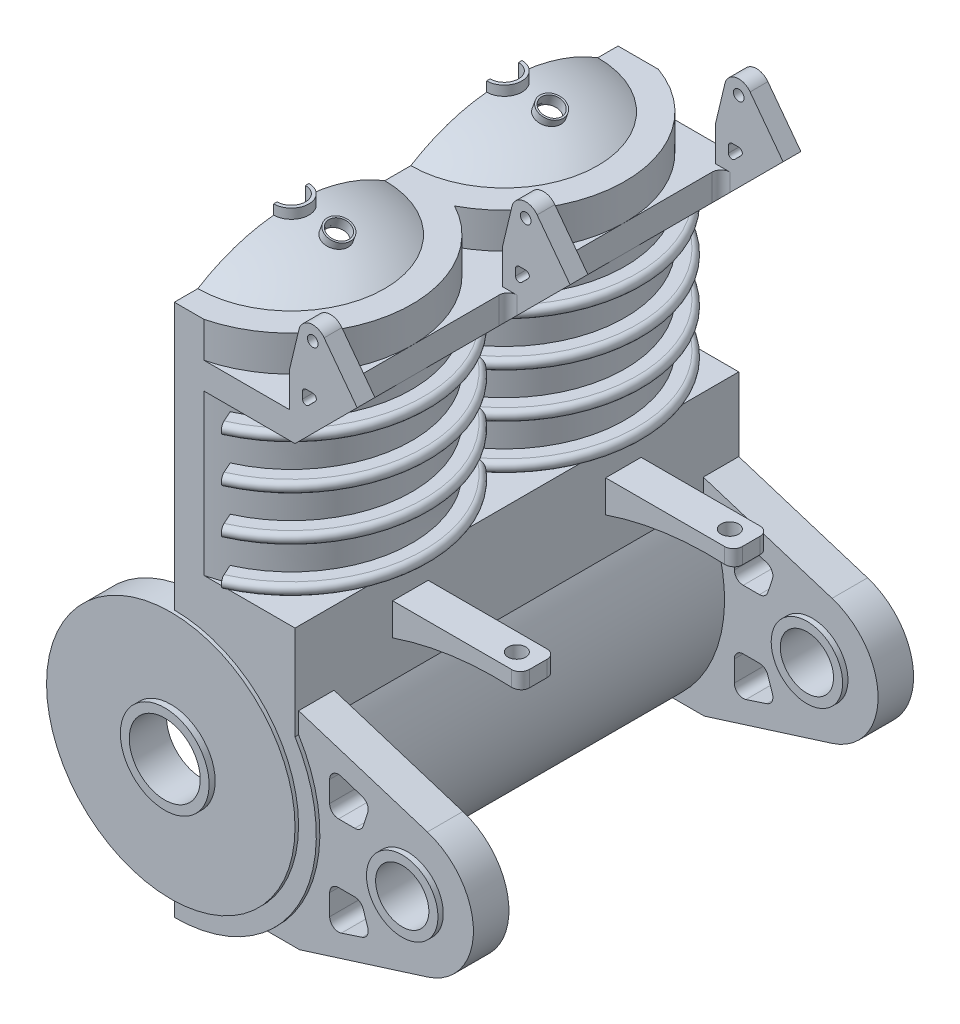
from build123d import *

# Parameters (mm, degrees)
BOSS_EXTRUDE1_DEPTH  = 25
SKETCH2_R            = 5
CUT_EXTRUDE1_DEPTH   = 20
SKETCH3_R            = 7
CUT_EXTRUDE2_DEPTH   = 39.394275615
CUT_EXTRUDE3_DEPTH   = 9
SKETCH6_W            = 0.51
SKETCH6_H            = 10
REVOLVE1_ANGLE       = 156
LPATTERN1_COUNT      = 2
LPATTERN1_PITCH      = 12
SKETCH7_R            = 5
CUT_EXTRUDE4_DEPTH   = 15
BOSS_EXTRUDE2_START  = -1
SKETCH8_R            = 7
SKETCH8_R_2          = 2.5
BOSS_EXTRUDE2_DEPTH  = 1.5
LPATTERN2_COUNT      = 3
LPATTERN2_PITCH      = 12
BOSS_EXTRUDE3_START  = 0.2
SKETCH9_R            = 2.5
BOSS_EXTRUDE3_DEPTH  = 0.2
BOSS_EXTRUDE4_START  = -1.6
SKETCH11_R           = 2.5
SKETCH11_R_2         = 2
BOSS_EXTRUDE4_DEPTH  = 2.1
LPATTERN3_COUNT      = 3
LPATTERN3_PITCH      = 12.22
BOSS_EXTRUDE5_START  = 2
BOSS_EXTRUDE5_DEPTH  = 2
SKETCH13_R           = 2.013
BOSS_EXTRUDE6_DEPTH  = 2
LPATTERN4_COUNT      = 2
LPATTERN4_PITCH      = 22.8
BOSS_EXTRUDE7_START  = 0.3
SKETCH14_R           = 2.013
SKETCH14_R_2         = 1.5
BOSS_EXTRUDE7_DEPTH  = 2.6
LPATTERN5_COUNT      = 2
LPATTERN5_PITCH      = 22.8
CUT_EXTRUDE5_DEPTH   = 43.786849685
REVOLVE7_ANGLE       = 180
LPATTERN6_COUNT      = 2
LPATTERN6_PITCH      = 12
SKETCH17_R           = 0.995
CUT_EXTRUDE6_DEPTH   = 43.786849615
BOSS_EXTRUDE8_START  = 1.2
BOSS_EXTRUDE8_DEPTH  = 0.8
SKETCH19_R           = 0.6
CUT_EXTRUDE11_DEPTH  = 41.399838707
SKETCH20_R           = 0.3
BOSS_EXTRUDE9_DEPTH  = 1
LPATTERN7_COUNT      = 3
LPATTERN7_PITCH      = 12
FILLET1_R            = 0.5
BOSS_EXTRUDE10_START = -5.5
BOSS_EXTRUDE10_DEPTH = 2
LPATTERN8_COUNT      = 2
LPATTERN8_PITCH      = 12
SKETCH22_R           = 0.5
CUT_EXTRUDE12_DEPTH  = 2
FILLET2_R            = 0.5
SKETCH23_W           = 8.786721834
SKETCH23_H           = 1.81963398
CUT_EXTRUDE13_DEPTH  = 45.697648838
SKETCH24_R           = 0.3
BOSS_EXTRUDE11_DEPTH = 1
LPATTERN9_COUNT      = 3
LPATTERN9_PITCH      = 12
EXTRUDE_THIN1_START  = 1.9
SKETCH19_2_R         = 0.7
SKETCH19_2_R_2       = 0.6
EXTRUDE_THIN1_DEPTH  = 0.5


with BuildPart() as part:
    # Sketch1 → Boss-Extrude1 (new body)
    with BuildSketch(Plane.XY):
        with BuildLine():
            Line((0, 0), (0, 28.02))
            Line((0, 28.02), (6.8, 28.02))
            Line((6.8, 28.02), (6.8, 12.214261501))
            ThreePointArc((6.8, 12.214261501), (6.989781542, 4.108605135), (0, 0))
        make_face()
    extrude(amount=BOSS_EXTRUDE1_DEPTH)

    # Sketch2 → Cut-Extrude1 (cut)
    with BuildSketch(Plane(origin=(0, 28.02, 0), x_dir=(1, 0, 0), z_dir=(0, 1, 0))):
        with Locations((0, -6.41)):
            Circle(SKETCH2_R)
        with Locations((0, -18.41)):
            Circle(SKETCH2_R)
    extrude(amount=-CUT_EXTRUDE1_DEPTH, mode=Mode.SUBTRACT)

    # Sketch3 → Cut-Extrude2 (cut, through all)
    with BuildSketch(Plane.XY.offset(25)):
        with Locations((0, 8)):
            Circle(SKETCH3_R)
    extrude(amount=-CUT_EXTRUDE2_DEPTH, mode=Mode.SUBTRACT)

    # Sketch4 → Cut-Extrude3 (cut)
    with BuildSketch(Plane(origin=(0, 26.52, 0), x_dir=(1, 0, 0), z_dir=(0, 1, 0))):
        with BuildLine():
            Line((0, 0.39), (11.867696921, 0.39))
            Line((11.867696921, 0.39), (11.867696921, -25.21))
            Line((11.867696921, -25.21), (0, -25.21))
            ThreePointArc((0, -25.21), (6.596969001, -20.05924225), (3.2, -12.41))
            ThreePointArc((3.2, -12.41), (6.596969001, -4.76075775), (0, 0.39))
        make_face()
    extrude(amount=-CUT_EXTRUDE3_DEPTH, mode=Mode.SUBTRACT)

    # Sketch6 → Revolve1 (revolve)
    with BuildSketch(Plane.ZY):
        with Locations((0.425, 22.17)):
            Rectangle(SKETCH6_W, SKETCH6_H)
        with BuildLine():
            Line((0.17, 25.87), (-1.07, 25.87))
            ThreePointArc((-1.07, 25.87), (-1.37, 25.57), (-1.07, 25.27))
            Line((-1.07, 25.27), (0.17, 25.27))
            Line((0.17, 25.27), (0.17, 25.87))
        make_face()
        with BuildLine():
            Line((0.17, 23.37), (-1.07, 23.37))
            ThreePointArc((-1.07, 23.37), (-1.37, 23.07), (-1.07, 22.77))
            Line((-1.07, 22.77), (0.17, 22.77))
            Line((0.17, 22.77), (0.17, 23.37))
        make_face()
        with BuildLine():
            Line((0.17, 20.87), (-1.07, 20.87))
            ThreePointArc((-1.07, 20.87), (-1.37, 20.57), (-1.07, 20.27))
            Line((-1.07, 20.27), (0.17, 20.27))
            Line((0.17, 20.27), (0.17, 20.87))
        make_face()
        with BuildLine():
            Line((0.17, 18.37), (-1.07, 18.37))
            ThreePointArc((-1.07, 18.37), (-1.37, 18.07), (-1.07, 17.77))
            Line((-1.07, 17.77), (0.17, 17.77))
            Line((0.17, 17.77), (0.17, 18.37))
        make_face()
    revolve1 = revolve(axis=Axis((0, 28.02, 6.41), (0, -1, 0)), revolution_arc=REVOLVE1_ANGLE)

    # LPattern1: Revolve1 ×2
    with Locations(*[(0, 0, i * LPATTERN1_PITCH) for i in range(1, LPATTERN1_COUNT)]):
        add(revolve1)

    # Sketch7 → Cut-Extrude4 (cut)
    with BuildSketch(Plane(origin=(0, 28.02, 0), x_dir=(1, 0, 0), z_dir=(0, 1, 0))):
        with Locations((0, -6.41)):
            Circle(SKETCH7_R)
    extrude(amount=-CUT_EXTRUDE4_DEPTH, mode=Mode.SUBTRACT)

    # Sketch8 → Boss-Extrude2 (add)
    with BuildSketch(Plane(origin=(0, 0, 0), x_dir=(-1, 0, 0), z_dir=(0, 0, -1)).offset(BOSS_EXTRUDE2_START)):
        with Locations((0, 8)):
            Circle(SKETCH8_R)
        with Locations((0, 8)):
            Circle(SKETCH8_R_2, mode=Mode.SUBTRACT)
    boss_extrude2 = extrude(amount=BOSS_EXTRUDE2_DEPTH)

    # LPattern2: Boss-Extrude2 ×3
    with Locations(*[(0, 0, i * LPATTERN2_PITCH) for i in range(1, LPATTERN2_COUNT)]):
        add(boss_extrude2)

    # Sketch9 → Boss-Extrude3 (add)
    with BuildSketch(Plane.XY.offset(25).offset(BOSS_EXTRUDE3_START)):
        with BuildLine():
            ThreePointArc((0, 1), (7, 8), (0, 15))
            ThreePointArc((0, 15), (-7, 8), (0, 1))
        make_face()
        with Locations((0, 8)):
            Circle(SKETCH9_R, mode=Mode.SUBTRACT)
    extrude(amount=-BOSS_EXTRUDE3_DEPTH)

    # Sketch11 → Boss-Extrude4 (add)
    with BuildSketch(Plane(origin=(0, 0, -0.5), x_dir=(-1, 0, 0), z_dir=(0, 0, -1)).offset(BOSS_EXTRUDE4_START)):
        with Locations((0, 8)):
            Circle(SKETCH11_R)
        with Locations((0, 8)):
            Circle(SKETCH11_R_2, mode=Mode.SUBTRACT)
    boss_extrude4 = extrude(amount=BOSS_EXTRUDE4_DEPTH)

    # LPattern3: Boss-Extrude4 ×3
    with Locations(*[(0, 0, i * LPATTERN3_PITCH) for i in range(1, LPATTERN3_COUNT)]):
        add(boss_extrude4)

    # Sketch12 → Boss-Extrude5 (add)
    with BuildSketch(Plane(origin=(0, 28.02, 0), x_dir=(1, 0, 0), z_dir=(0, 1, 0)).offset(BOSS_EXTRUDE5_START)):
        with BuildLine():
            Line((0, -13.41), (0, -11.41))
            ThreePointArc((0, -11.41), (5, -6.41), (0, -1.41))
            Line((0, -1.41), (0, 0))
            Line((0, 0), (2.269779725, 0))
            ThreePointArc((2.269779725, 0), (5.553129844, -2.485366395), (6.8, -6.41))
            ThreePointArc((6.8, -6.41), (5.830951895, -9.908571137), (3.2, -12.41))
            ThreePointArc((3.2, -12.41), (5.830951895, -14.911428863), (6.8, -18.41))
            ThreePointArc((6.8, -18.41), (5.368553353, -22.583563813), (1.676872088, -25))
            Line((1.676872088, -25), (0, -25))
            Line((0, -25), (0, -23.41))
            ThreePointArc((0, -23.41), (5, -18.41), (0, -13.41))
        make_face()
    extrude(amount=-BOSS_EXTRUDE5_DEPTH)

    # Sketch13 → Boss-Extrude6 (add)
    with BuildSketch(Plane(origin=(0, 0, 0), x_dir=(-1, 0, 0), z_dir=(0, 0, -1))):
        with BuildLine():
            Line((-6.8, 12.214261501), (-6.8, 13.385977618))
            Line((-6.8, 13.385977618), (-14.055618516, 11.098289887))
            ThreePointArc((-14.055618516, 11.098289887), (-16.65, 7.56), (-14.055618516, 4.021710113))
            Line((-14.055618516, 4.021710113), (-6.85574719, 1.751599403))
            Line((-6.85574719, 1.751599403), (-4.99574719, 1.751599403))
            ThreePointArc((-4.99574719, 1.751599403), (-7.883637326, 6.640491811), (-6.8, 12.214261501))
        make_face()
        with Locations((-12.94, 7.56)):
            Circle(SKETCH13_R, mode=Mode.SUBTRACT)
    boss_extrude6 = extrude(amount=-BOSS_EXTRUDE6_DEPTH)

    # LPattern4: Boss-Extrude6 ×2
    with Locations(*[(0, 0, i * LPATTERN4_PITCH) for i in range(1, LPATTERN4_COUNT)]):
        add(boss_extrude6)

    # Sketch14 → Boss-Extrude7 (add)
    with BuildSketch(Plane(origin=(0, 0, 0), x_dir=(-1, 0, 0), z_dir=(0, 0, -1)).offset(BOSS_EXTRUDE7_START)):
        with Locations((-12.94, 7.56)):
            Circle(SKETCH14_R)
        with Locations((-12.94, 7.56)):
            Circle(SKETCH14_R_2, mode=Mode.SUBTRACT)
    boss_extrude7 = extrude(amount=-BOSS_EXTRUDE7_DEPTH)

    # LPattern5: Boss-Extrude7 ×2
    with Locations(*[(0, 0, i * LPATTERN5_PITCH) for i in range(1, LPATTERN5_COUNT)]):
        add(boss_extrude7)

    # Sketch15 → Cut-Extrude5 (cut, through all)
    with BuildSketch(Plane(origin=(0, 0, 0), x_dir=(-1, 0, 0), z_dir=(0, 0, -1))):
        with BuildLine():
            Line((-9.206498261, 11.383474577), (-10.378351292, 10.999959039))
            ThreePointArc((-10.378351292, 10.999959039), (-10.668816803, 10.750807688), (-10.698030326, 10.369240944))
            Line((-10.698030326, 10.369240944), (-10.439308337, 9.578701533))
            ThreePointArc((-10.439308337, 9.578701533), (-10.257572065, 9.32940026), (-9.964109772, 9.234221063))
            Line((-9.964109772, 9.234221063), (-9.050978731, 9.234221063))
            ThreePointArc((-9.050978731, 9.234221063), (-8.69742534, 9.380667672), (-8.550978731, 9.734221063))
            Line((-8.550978731, 9.734221063), (-8.550978731, 10.908276012))
            ThreePointArc((-8.550978731, 10.908276012), (-8.757516438, 11.313096815), (-9.206498261, 11.383474577))
        make_face()
        with BuildLine():
            Line((-8.550978731, 5.385778937), (-8.550978731, 4.211723988))
            ThreePointArc((-8.550978731, 4.211723988), (-8.757516438, 3.806903185), (-9.206498261, 3.736525423))
            Line((-9.206498261, 3.736525423), (-10.378351292, 4.120040961))
            ThreePointArc((-10.378351292, 4.120040961), (-10.668816803, 4.369192312), (-10.698030326, 4.750759056))
            Line((-10.698030326, 4.750759056), (-10.439308337, 5.541298467))
            ThreePointArc((-10.439308337, 5.541298467), (-10.257572065, 5.79059974), (-9.964109772, 5.885778937))
            Line((-9.964109772, 5.885778937), (-9.050978731, 5.885778937))
            ThreePointArc((-9.050978731, 5.885778937), (-8.69742534, 5.739332328), (-8.550978731, 5.385778937))
        make_face()
    extrude(amount=-CUT_EXTRUDE5_DEPTH, mode=Mode.SUBTRACT)

    # Sketch16 → Revolve7 (revolve)
    with BuildSketch(Plane.ZY):
        with BuildLine():
            Line((18.41, 31.4), (18.41, 31.52))
            ThreePointArc((18.41, 31.52), (15.671387212, 31.137692031), (13.142173124, 30.02))
            Line((13.142173124, 30.02), (13.373691828, 30.02))
            ThreePointArc((13.373691828, 30.02), (15.799023171, 31.048756477), (18.41, 31.4))
        make_face()
    revolve7 = revolve(axis=Axis((0, 30.02, 18.41), (0, -1, 0)), revolution_arc=REVOLVE7_ANGLE)

    # LPattern6: Revolve7 ×2
    with Locations(*[(0, 0, -i * LPATTERN6_PITCH) for i in range(1, LPATTERN6_COUNT)]):
        add(revolve7)

    # Sketch17 → Cut-Extrude6 (cut, through all)
    with BuildSketch(Plane(origin=(0, 30.02, 0), x_dir=(1, 0, 0), z_dir=(0, 1, 0))):
        with Locations((0, -6.41)):
            Circle(SKETCH17_R)
        with Locations((0, -18.41)):
            Circle(SKETCH17_R)
    extrude(amount=CUT_EXTRUDE6_DEPTH, mode=Mode.SUBTRACT)

    # Sketch18 → Boss-Extrude8 (add)
    with BuildSketch(Plane(origin=(0, 30.02, 0), x_dir=(1, 0, 0), z_dir=(0, 1, 0)).offset(BOSS_EXTRUDE8_START)):
        with BuildLine():
            Line((0, -5.415), (0, -5.61))
            ThreePointArc((0, -5.61), (0.8, -6.41), (0, -7.21))
            Line((0, -7.21), (0, -7.405))
            ThreePointArc((0, -7.405), (0.995, -6.41), (0, -5.415))
        make_face()
        with BuildLine():
            Line((0, -17.415), (0, -17.61))
            ThreePointArc((0, -17.61), (0.8, -18.41), (0, -19.21))
            Line((0, -19.21), (0, -19.405))
            ThreePointArc((0, -19.405), (0.995, -18.41), (0, -17.415))
        make_face()
    extrude(amount=BOSS_EXTRUDE8_DEPTH)

    # Sketch19 → Cut-Extrude11 (cut, through all)
    with BuildSketch(Plane(origin=(9.648242021, 26.508327091, 0), x_dir=(0, 0, 1), z_dir=(0.34202014332565694, 0.9396926207859128, 0))):
        with Locations((6.41, -8.301008223)):
            Circle(SKETCH19_R)
        with Locations((18.396707779, -8.301008223)):
            Circle(SKETCH19_R)
    extrude(amount=CUT_EXTRUDE11_DEPTH, mode=Mode.SUBTRACT)

    # Sketch20 → Boss-Extrude9 (add)
    with BuildSketch(Plane(origin=(0, 0, 0), x_dir=(-1, 0, 0), z_dir=(0, 0, -1))):
        with BuildLine():
            Line((-6.8, 26.52), (-6.5, 26.52))
            Line((-6.5, 26.52), (-6.5, 30.02))
            Line((-6.5, 30.02), (-8.82, 30.02))
            Line((-8.82, 30.02), (-9.944299782, 31.144299782))
            ThreePointArc((-9.944299782, 31.144299782), (-10.707523601, 31.122306001), (-10.641615253, 30.361615253))
            Line((-10.641615253, 30.361615253), (-6.8, 26.52))
        make_face()
        with Locations((-10.315530842, 30.773068722)):
            Circle(SKETCH20_R, mode=Mode.SUBTRACT)
        with BuildLine():
            Line((-7.941705141, 29.141705141), (-7.563773985, 28.763773985))
            ThreePointArc((-7.563773985, 28.763773985), (-7.345815943, 28.720419435), (-7.222352629, 28.905195342))
            Line((-7.222352629, 28.905195342), (-7.222352629, 29.283126498))
            ThreePointArc((-7.222352629, 29.283126498), (-7.280931273, 29.424547854), (-7.422352629, 29.483126498))
            Line((-7.422352629, 29.483126498), (-7.800283785, 29.483126498))
            ThreePointArc((-7.800283785, 29.483126498), (-7.985059692, 29.359663184), (-7.941705141, 29.141705141))
        make_face(mode=Mode.SUBTRACT)
    boss_extrude9 = extrude(amount=-BOSS_EXTRUDE9_DEPTH)

    # LPattern7: Boss-Extrude9 ×3
    with Locations(*[(0, 0, i * LPATTERN7_PITCH) for i in range(1, LPATTERN7_COUNT)]):
        add(boss_extrude9)

    # Fillet1
    fillet1_edges = [part.edges().sort_by_distance(p)[0] for p in [
        (6.8, 27.27, 24),
        (6.8, 27.27, 1),
        (6.8, 27.27, 13),
        (6.8, 27.27, 12),
    ]]
    fillet(fillet1_edges, radius=FILLET1_R)

    # Sketch21 → Boss-Extrude10 (add)
    with BuildSketch(Plane(origin=(0, 0, 0), x_dir=(-1, 0, 0), z_dir=(0, 0, -1)).offset(BOSS_EXTRUDE10_START)):
        with BuildLine():
            Line((-6.8, 16.1), (-14, 16.1))
            Line((-14, 16.1), (-14, 15.2))
            ThreePointArc((-14, 15.2), (-10.353527401, 15.112639973), (-6.8, 14.289938808))
            Line((-6.8, 14.289938808), (-6.8, 16.1))
        make_face()
    boss_extrude10 = extrude(amount=-BOSS_EXTRUDE10_DEPTH)

    # LPattern8: Boss-Extrude10 ×2
    with Locations(*[(0, 0, i * LPATTERN8_PITCH) for i in range(1, LPATTERN8_COUNT)]):
        add(boss_extrude10)

    # Sketch22 → Cut-Extrude12 (cut)
    with BuildSketch(Plane(origin=(0, 16.1, 0), x_dir=(1, 0, 0), z_dir=(0, 1, 0))):
        with Locations((12.8, -6.5)):
            Circle(SKETCH22_R)
        with Locations((12.8, -18.5)):
            Circle(SKETCH22_R)
    extrude(amount=-CUT_EXTRUDE12_DEPTH, mode=Mode.SUBTRACT)

    # Fillet2
    fillet2_edges = [part.edges().sort_by_distance(p)[0] for p in [
        (14, 15.65, 5.5),
        (14, 15.65, 7.5),
        (14, 15.65, 17.5),
        (14, 15.65, 19.5),
    ]]
    fillet(fillet2_edges, radius=FILLET2_R)

    # Sketch23 → Cut-Extrude13 (cut, through all)
    with BuildSketch(Plane.XY.offset(25)):
        with Locations((10.893360917, 30.92981699)):
            Rectangle(SKETCH23_W, SKETCH23_H)
    extrude(amount=-CUT_EXTRUDE13_DEPTH, mode=Mode.SUBTRACT)

    # Sketch24 → Boss-Extrude11 (add)
    with BuildSketch(Plane.XY.offset(25)):
        with BuildLine():
            Line((7.021871211, 32.205783713), (6.5, 30.02))
            Line((6.5, 30.02), (10.3, 30.02))
            Line((10.3, 30.02), (8.44, 32.5))
            ThreePointArc((8.44, 32.5), (7.637486319, 32.803319413), (7.021871211, 32.205783713))
        make_face()
        with Locations((7.8, 32.02)):
            Circle(SKETCH24_R, mode=Mode.SUBTRACT)
    boss_extrude11 = extrude(amount=-BOSS_EXTRUDE11_DEPTH)

    # LPattern9: Boss-Extrude11 ×3
    with Locations(*[(0, 0, -i * LPATTERN9_PITCH) for i in range(1, LPATTERN9_COUNT)]):
        add(boss_extrude11)

    # Sketch19<2> → Extrude-Thin1 (add)
    # profile 1 of 2: a face of its own
    with BuildSketch(Plane(origin=(9.648242021, 26.508327091, 0), x_dir=(0, 0, 1), z_dir=(0.34202014332565694, 0.9396926207859128, 0)).offset(EXTRUDE_THIN1_START)):
        with Locations((6.41, -8.301008223)):
            Circle(SKETCH19_2_R)
        with Locations((6.41, -8.301008223)):
            Circle(SKETCH19_2_R_2, mode=Mode.SUBTRACT)
    # profile 2 of 2: a face of its own
    with BuildSketch(Plane(origin=(9.648242021, 26.508327091, 0), x_dir=(0, 0, 1), z_dir=(0.34202014332565694, 0.9396926207859128, 0)).offset(EXTRUDE_THIN1_START)):
        with Locations((18.396707779, -8.301008223)):
            Circle(SKETCH19_2_R)
        with Locations((18.396707779, -8.301008223)):
            Circle(SKETCH19_2_R_2, mode=Mode.SUBTRACT)
    extrude(amount=EXTRUDE_THIN1_DEPTH)


solid = part.part
